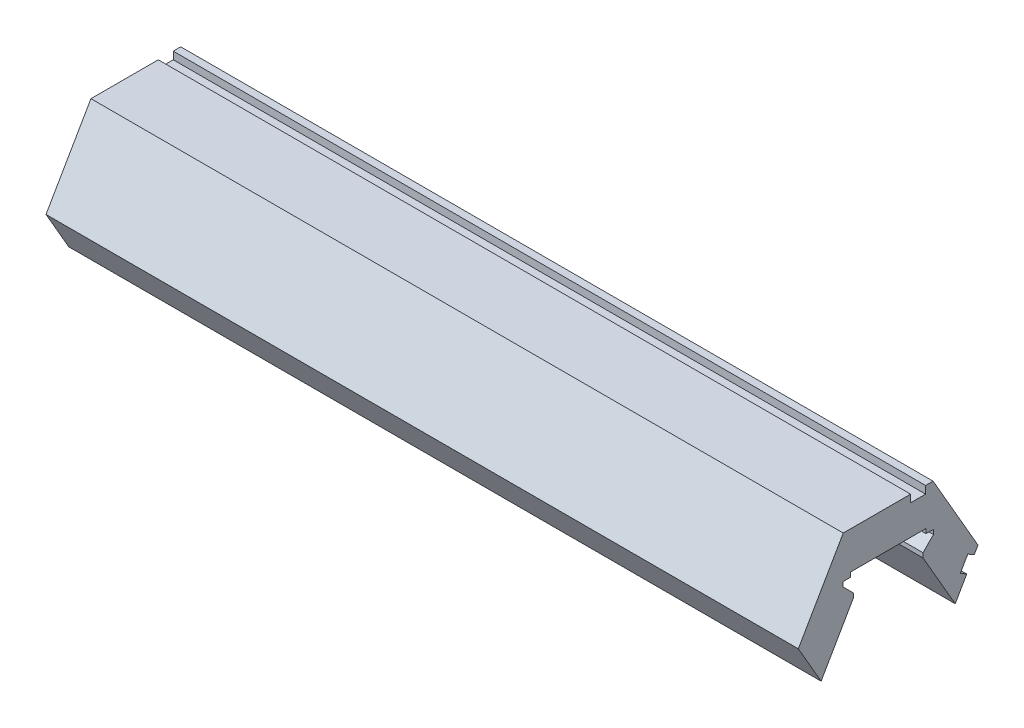
from build123d import *

# Parameters (mm, degrees)
BOSS_EXTRUDE2_DEPTH = 50.25
SKETCH3_W           = 2
SKETCH3_H           = 1
CUT_EXTRUDE2_DEPTH  = 102.746007293


with BuildPart() as part:
    # LED Segment → Boss-Extrude2 (new, symmetric)
    with BuildSketch(Plane(origin=(0, 0, 0), x_dir=(0, 0, -1), z_dir=(1, 0, 0))):
        Polygon((8.957863896, -5.269134295), (12, 0), (6, 10.392304845), (-6, 10.392304845), (-12, 0), (-8.957863896, -5.269134295), (-4.65, 2.192304845), (-4.65, 2.792304845), (-6.05, 4.192304845), (-6.05, 4.792304845), (-5.05, 4.792304845), (-5.05, 5.392304845), (5.05, 5.392304845), (5.05, 4.792304845), (6.05, 4.792304845), (6.05, 4.192304845), (4.65, 2.792304845), (4.65, 2.192304845), align=None)
    extrude(amount=BOSS_EXTRUDE2_DEPTH, both=True)

    # Sketch3 → Cut-Extrude2 (cut, through all)
    with BuildSketch(Plane(origin=(50.25, 0, 0), x_dir=(0, 0, -1), z_dir=(1, 0, 0))):
        with Locations((4, 9.892304845)):
            Rectangle(SKETCH3_W, SKETCH3_H)
        Polygon((10.5, -2.598076211), (11.5, -0.866025404), (10.633974596, -0.366025404), (9.633974596, -2.098076211), align=None)
    extrude(amount=-CUT_EXTRUDE2_DEPTH, mode=Mode.SUBTRACT)


solid = part.part
